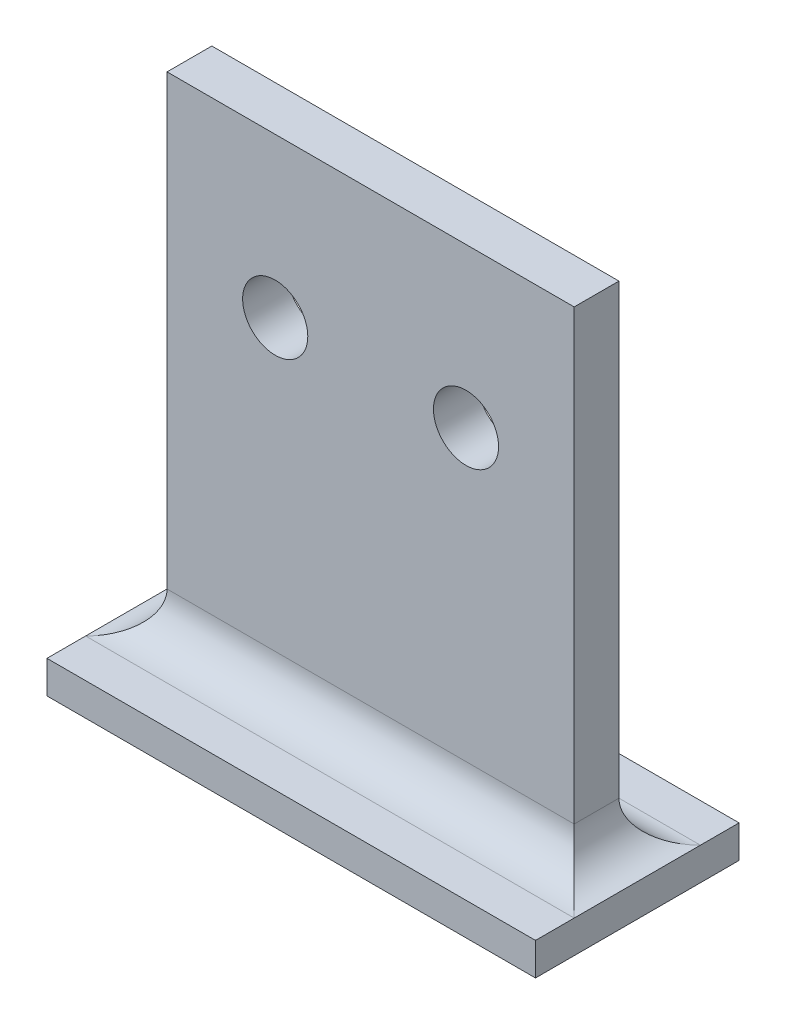
from build123d import *

# Parameters (mm, degrees)
SKETCH1_W           = 60
SKETCH1_H           = 4
BOSS_EXTRUDE1_DEPTH = 25
SKETCH2_W           = 50
SKETCH2_H           = 5.5
BOSS_EXTRUDE2_DEPTH = 60
FILLET1_R           = 5
SKETCH3_R           = 4
CUT_EXTRUDE1_DEPTH  = 60


with BuildPart() as part:
    # Sketch1 → Boss-Extrude1 (new body)
    with BuildSketch(Plane.XY):
        with Locations((0, 0.807157058)):
            Rectangle(SKETCH1_W, SKETCH1_H)
    extrude(amount=BOSS_EXTRUDE1_DEPTH)

    # Sketch2 → Boss-Extrude2 (add)
    with BuildSketch(Plane(origin=(0, 2.807157058, 0), x_dir=(1, 0, 0), z_dir=(0, 1, 0))):
        with Locations((0, -12.5)):
            Rectangle(SKETCH2_W, SKETCH2_H)
    extrude(amount=BOSS_EXTRUDE2_DEPTH)

    # Fillet1
    fillet1_edges = [part.edges().sort_by_distance(p)[0] for p in [
        (25, 2.807157058, 12.5),
        (0, 2.807157058, 9.75),
        (-25, 2.807157058, 12.5),
        (0, 2.807157058, 15.25),
    ]]
    fillet(fillet1_edges, radius=FILLET1_R - 0.0001)  # a hair under: the kernel refuses the full size

    # Sketch3 → Cut-Extrude1 (cut)
    with BuildSketch(Plane.XY.offset(15.25)):
        with Locations((-11.715, 43.307157058)):
            Circle(SKETCH3_R)
        with Locations((11.715, 43.307157058)):
            Circle(SKETCH3_R)
    extrude(amount=-CUT_EXTRUDE1_DEPTH, mode=Mode.SUBTRACT)


solid = part.part
